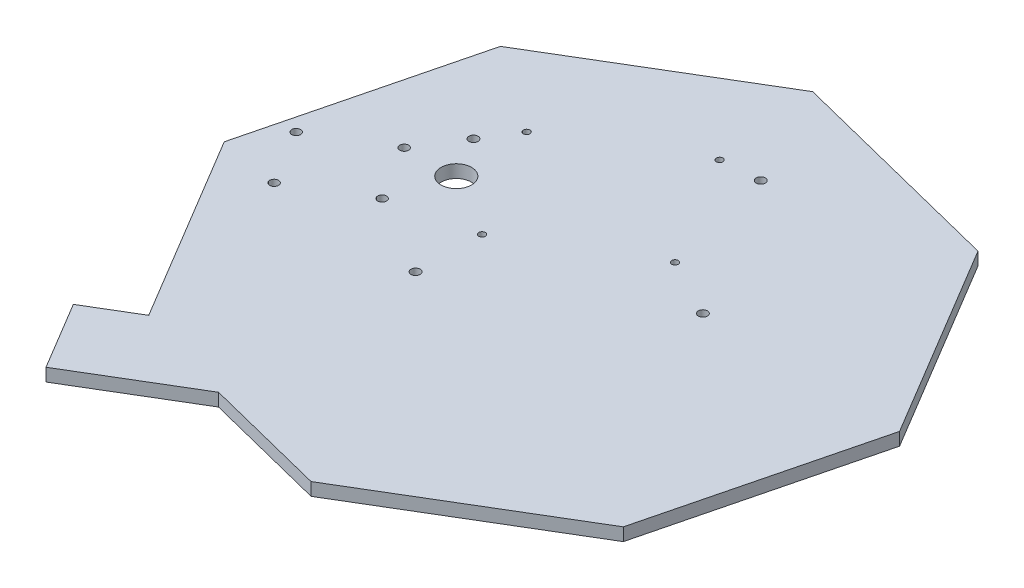
from build123d import *

# Parameters (mm, degrees)
BOSS_EXTRUDE2_DEPTH = 5.334
BOSS_EXTRUDE3_DEPTH = 5.334
SKETCH3_R           = 1.3716
CUT_EXTRUDE1_DEPTH  = 184.29556357
SKETCH4_R           = 6.35
CUT_EXTRUDE2_DEPTH  = 184.29556357
SKETCH5_R           = 1.905
CUT_EXTRUDE3_DEPTH  = 184.29556357
SKETCH6_R           = 1.8415
CUT_EXTRUDE4_DEPTH  = 184.29556357


with BuildPart() as part:
    # Sketch1 → Boss-Extrude2 (new body)
    with BuildSketch(Plane(origin=(0, 0, 0), x_dir=(1, 0, 0), z_dir=(0, 1, 0))):
        Polygon((73.764977758, 99.321348004), (-18.071082704, 122.390514677), (-99.321348004, 73.764977758), (-122.390514677, -18.071082704), (-73.764977758, -99.321348004), (18.071082704, -122.390514677), (99.321348004, -73.764977758), (122.390514677, 18.071082704), align=None)
    extrude(amount=BOSS_EXTRUDE2_DEPTH)

    # Sketch2 → Boss-Extrude3 (add)
    with BuildSketch(Plane(origin=(0, 5.334, 0), x_dir=(-1, 0, 0), z_dir=(0, 1, 0))):
        Polygon((75.591082235, 96.270040344), (95.206631479, 108.009283415), (78.249947043, 136.342854545), (33.35213433, 109.473031516), (73.764977758, 99.321348004), align=None)
    extrude(amount=-BOSS_EXTRUDE3_DEPTH)

    # Sketch3 → Cut-Extrude1 (cut, through all)
    with BuildSketch(Plane.XZ):
        with Locations((-63.056087654, -48.387784923)):
            Circle(SKETCH3_R)
        with Locations((-35.416692023, -2.204063982)):
            Circle(SKETCH3_R)
        with Locations((14.794755029, -32.253917523)):
            Circle(SKETCH3_R)
        with Locations((-12.844640601, -78.437638464)):
            Circle(SKETCH3_R)
    extrude(amount=-CUT_EXTRUDE1_DEPTH, mode=Mode.SUBTRACT)

    # Sketch4 → Cut-Extrude2 (cut, through all)
    with BuildSketch(Plane.XZ):
        with Locations((-61.737440704, -17.814468138)):
            Circle(SKETCH4_R)
    extrude(amount=-CUT_EXTRUDE2_DEPTH, mode=Mode.SUBTRACT)

    # Sketch5 → Cut-Extrude3 (cut, through all)
    with BuildSketch(Plane.XZ):
        with Locations((3.13905988, -79.581798478)):
            Circle(SKETCH5_R)
        with Locations((-71.617977793, -34.842238775)):
            Circle(SKETCH5_R)
        with Locations((39.008969263, -19.645398012)):
            Circle(SKETCH5_R)
        with Locations((-35.74806841, 25.094161691)):
            Circle(SKETCH5_R)
    extrude(amount=-CUT_EXTRUDE3_DEPTH, mode=Mode.SUBTRACT)

    # Sketch6 → Cut-Extrude4 (cut, through all)
    with BuildSketch(Plane.XZ):
        with Locations((-110.932740788, -0.407532443)):
            Circle(SKETCH6_R)
        with Locations((-82.817120206, -17.233780845)):
            Circle(SKETCH6_R)
        with Locations((-97.236957205, 22.477275007)):
            Circle(SKETCH6_R)
        with Locations((-69.121336623, 5.651026606)):
            Circle(SKETCH6_R)
    extrude(amount=-CUT_EXTRUDE4_DEPTH, mode=Mode.SUBTRACT)


solid = part.part
